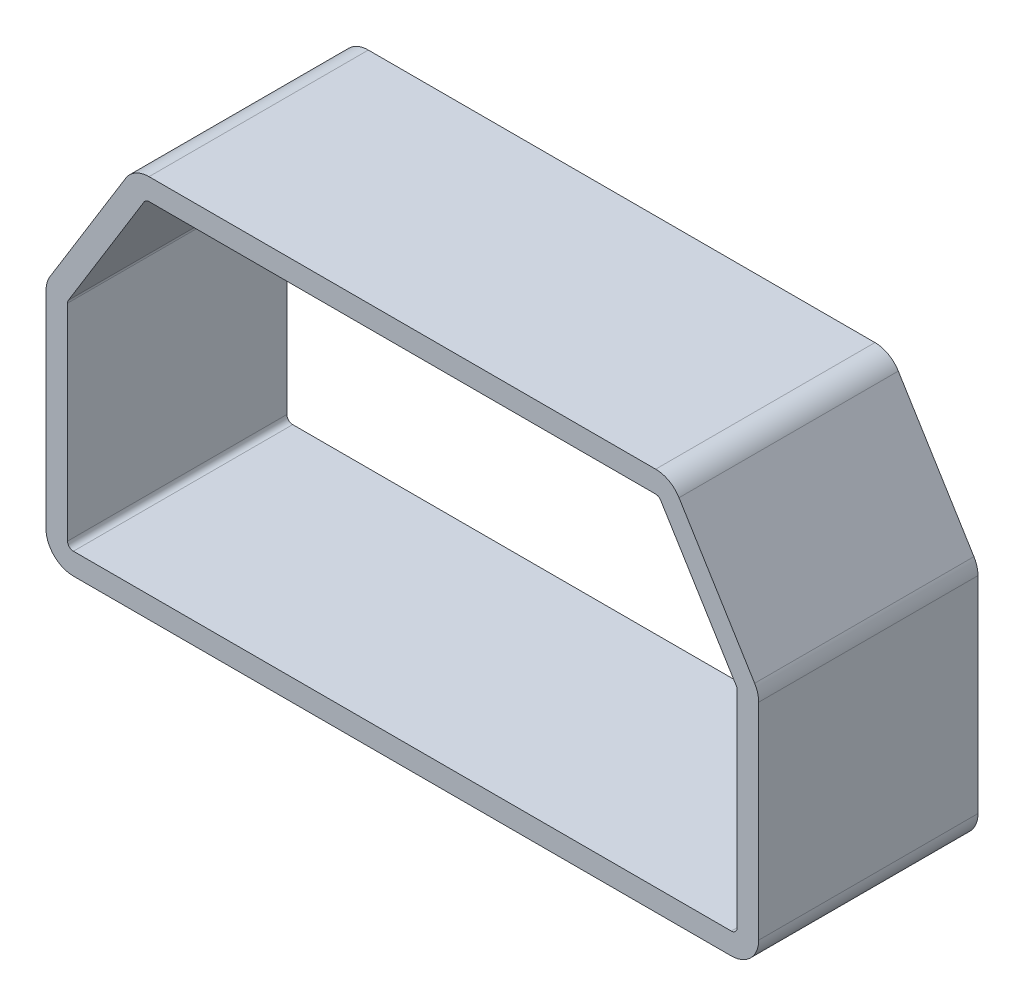
from build123d import *

# Parameters (mm, degrees)
SKETCH1_W           = 165.1
SKETCH1_H           = 88.9
BOSS_EXTRUDE1_DEPTH = 50.8
CUT_EXTRUDE1_DEPTH  = 107.634633211
FILLET1_R           = 6.35
SHELL1_T            = -5
CUT_EXTRUDE2_DEPTH  = 105.345316138


with BuildPart() as part:
    # Sketch1 → Boss-Extrude1 (new body)
    with BuildSketch(Plane.XY):
        Rectangle(SKETCH1_W, SKETCH1_H)
    extrude(amount=BOSS_EXTRUDE1_DEPTH)

    # Sketch2 → Cut-Extrude1 (cut, through all)
    with BuildSketch(Plane(origin=(0, 0, 0), x_dir=(-1, 0, 0), z_dir=(0, 0, -1))):
        Polygon((-82.55, 44.45), (-82.55, 11.43), (-62.23, 44.45), align=None)
        Polygon((82.55, 44.45), (62.23, 44.45), (82.55, 11.43), align=None)
    extrude(amount=-CUT_EXTRUDE1_DEPTH, mode=Mode.SUBTRACT)

    # Fillet1
    fillet1_edges = [part.edges().sort_by_distance(p)[0] for p in [
        (82.55, -44.45, 25.4),
        (82.55, 11.43, 25.4),
        (62.23, 44.45, 25.4),
        (-62.23, 44.45, 25.4),
        (-82.55, 11.43, 25.4),
        (-82.55, -44.45, 25.4),
    ]]
    fillet(fillet1_edges, radius=FILLET1_R)

    # Shell1
    shell1_openings = [part.faces().sort_by_distance(p)[0] for p in [
        (0, -1.56423777, 0),
    ]]
    offset(amount=SHELL1_T, openings=shell1_openings, kind=Kind.INTERSECTION)

    # Sketch4 → Cut-Extrude2 (cut, through all)
    with BuildSketch(Plane(origin=(0, 0, 45.8), x_dir=(-1, 0, 0), z_dir=(0, 0, -1))):
        with BuildLine():
            Line((-59.831389245, 38.807531525), (-77.349738728, 10.340213616))
            ThreePointArc((-77.349738728, 10.340213616), (-77.498970223, 10.000345469), (-77.55, 9.632682092))
            Line((-77.55, 9.632682092), (-77.55, -38.1))
            ThreePointArc((-77.55, -38.1), (-77.154594155, -39.054594155), (-76.2, -39.45))
            Line((-76.2, -39.45), (76.2, -39.45))
            ThreePointArc((76.2, -39.45), (77.154594155, -39.054594155), (77.55, -38.1))
            Line((77.55, -38.1), (77.55, 9.632682092))
            ThreePointArc((77.55, 9.632682092), (77.498970223, 10.000345469), (77.349738728, 10.340213616))
            Line((77.349738728, 10.340213616), (59.831389245, 38.807531525))
            ThreePointArc((59.831389245, 38.807531525), (59.340183904, 39.278487921), (58.681650518, 39.45))
            Line((58.681650518, 39.45), (-58.681650518, 39.45))
            ThreePointArc((-58.681650518, 39.45), (-59.340183904, 39.278487921), (-59.831389245, 38.807531525))
        make_face()
    extrude(amount=-CUT_EXTRUDE2_DEPTH, mode=Mode.SUBTRACT)


solid = part.part
